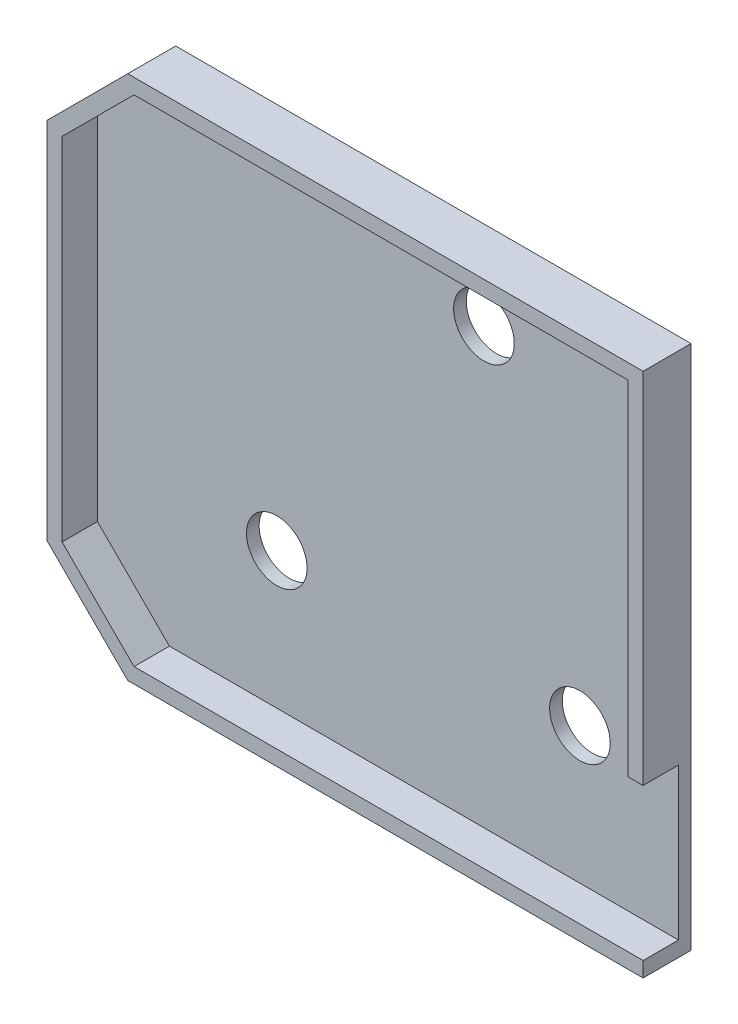
from build123d import *

# Parameters (mm, degrees)
BOSS_EXTRU_1_DEPTH      = 2.5
BOSS_EXTRU_2_DEPTH      = 7
ESQUISSE3_R             = 6
ENL_V_MAT_EXTRU_1_DEPTH = 10


with BuildPart() as part:
    # Esquisse1 → Boss.-Extru.1 (new body)
    with BuildSketch(Plane.XY):
        Polygon((0, -85), (16, -101), (118, -101), (118, 3), (16, 3), (0, -13), align=None)
    extrude(amount=BOSS_EXTRU_1_DEPTH)

    # Esquisse2 → Boss.-Extru.2 (add)
    with BuildSketch(Plane.XY.offset(2.5)):
        Polygon((3, -83.757359313), (17.242640687, -98), (115, -98), (118, -98), (118, -101), (16, -101), (0, -85), (0, -13), (16, 3), (118, 3), (118, -2.5), (118, -68), (115, -68), (115, 0), (17.242640687, 0), (3, -14.242640687), align=None)
    extrude(amount=BOSS_EXTRU_2_DEPTH)

    # Esquisse3 → Enlèv. mat.-Extru.1 (cut)
    with BuildSketch(Plane.XY.offset(2.5)):
        with Locations((98.5, -71)):
            Circle(ESQUISSE3_R)
        with Locations((79.5, -12)):
            Circle(ESQUISSE3_R)
        with Locations((38.5, -71)):
            Circle(ESQUISSE3_R)
    extrude(amount=-ENL_V_MAT_EXTRU_1_DEPTH, mode=Mode.SUBTRACT)


solid = part.part
